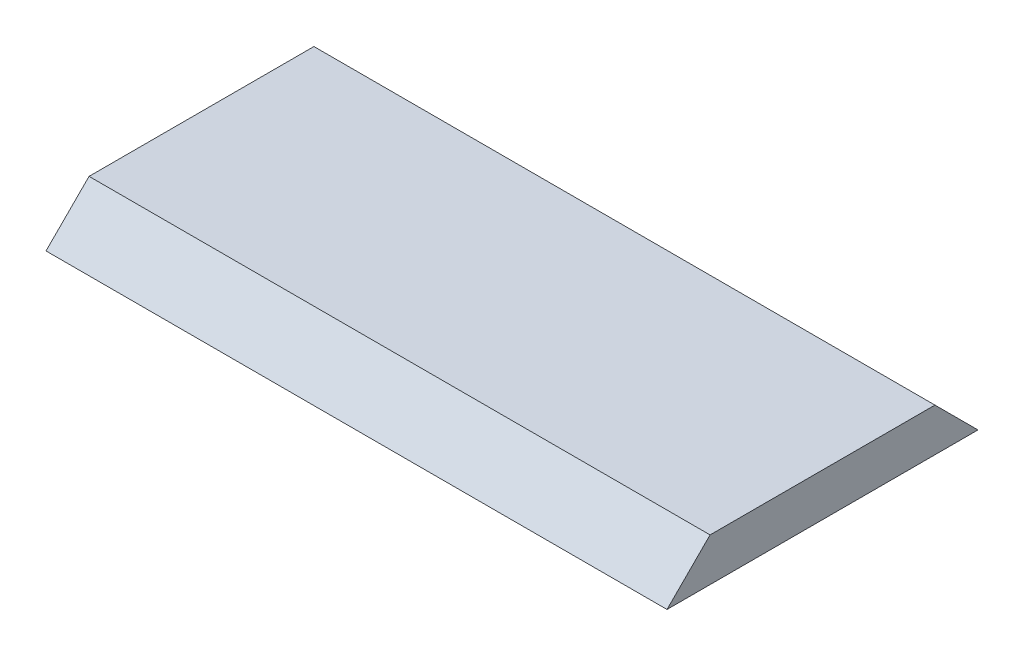
from build123d import *

# Parameters (mm, degrees)
SKETCH1_W           = 129.8
SKETCH1_H           = 65
BOSS_EXTRUDE1_DEPTH = 9
SKETCH2_R           = 2.35
CUT_EXTRUDE1_DEPTH  = 8
CHAMFER1_SIZE       = 1
CHAMFER2_SIZE       = 9


with BuildPart() as part:
    # Sketch1 → Boss-Extrude1 (new body)
    with BuildSketch(Plane(origin=(0, 0, 0), x_dir=(1, 0, 0), z_dir=(0, 1, 0))):
        Rectangle(SKETCH1_W, SKETCH1_H)
    extrude(amount=BOSS_EXTRUDE1_DEPTH)

    # Sketch2 → Cut-Extrude1 (cut)
    with BuildSketch(Plane.XZ):
        with Locations(Location((-32.45, 20, 0), (0, 0, 270))):
            Circle(SKETCH2_R)
        with Locations(Location((0, 20, 0), (0, 0, 270))):
            Circle(SKETCH2_R)
        with Locations(Location((32.45, 20, 0), (0, 0, 270))):
            Circle(SKETCH2_R)
        with Locations(Location((32.45, -20, 0), (0, 0, 90))):
            Circle(SKETCH2_R)
        with Locations(Location((0, -20, 0), (0, 0, 90))):
            Circle(SKETCH2_R)
        with Locations(Location((-32.45, -20, 0), (0, 0, 90))):
            Circle(SKETCH2_R)
    extrude(amount=-CUT_EXTRUDE1_DEPTH, mode=Mode.SUBTRACT)

    # Chamfer1
    chamfer1_edges = [part.edges().sort_by_distance(p)[0] for p in [
        (-32.45, 0, -22.35),
        (0, 0, -22.35),
        (32.45, 0, -22.35),
        (32.45, 0, 22.35),
        (0, 0, 22.35),
        (-32.45, 0, 22.35),
    ]]
    chamfer(chamfer1_edges, length=CHAMFER1_SIZE)

    # Chamfer2
    chamfer2_edges = [part.edges().sort_by_distance(p)[0] for p in [
        (0, 9, 32.5),
        (0, 9, -32.5),
    ]]
    chamfer(chamfer2_edges, length=CHAMFER2_SIZE - 0.0001)  # a hair under: the kernel refuses the full size


solid = part.part
